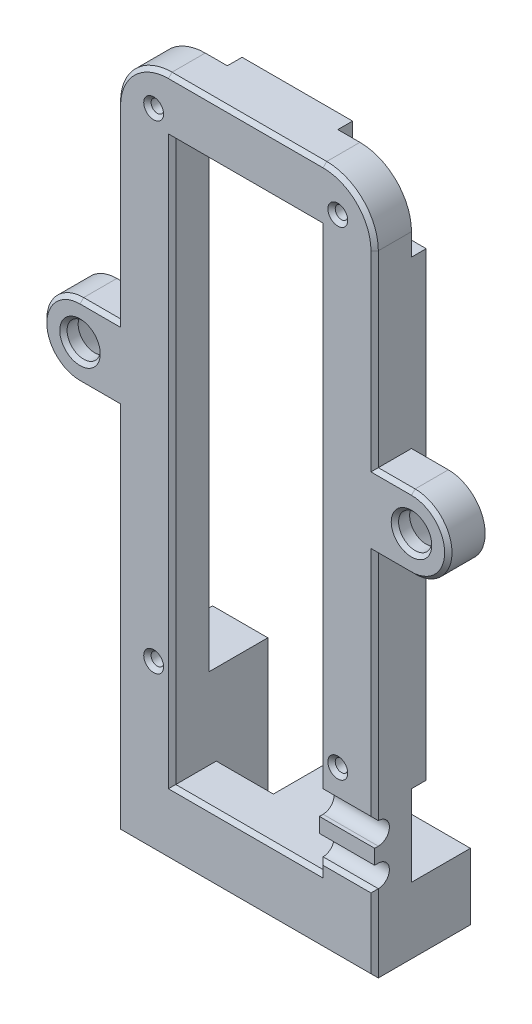
from build123d import *
from OCP.BRepFilletAPI import BRepFilletAPI_MakeChamfer

# Parameters (mm, degrees)
SKETCH1_R                = 0.85
BOSS_EXTRUDE1_DEPTH      = 5
BOSS_EXTRUDE2_DEPTH      = 2
SKETCH3_R                = 2.25
BOSS_EXTRUDE3_DEPTH      = 5
SKETCH4_R                = 3.5
CUT_EXTRUDE1_DEPTH       = 3
SKETCH5_W                = 10
SKETCH5_H                = 10
CUT_EXTRUDE2_DEPTH       = 47.770717335
FILLET1_R                = 7
BOSS_EXTRUDE4_DEPTH      = 5
BOSS_EXTRUDE4_DEPTH_BACK = 8
SKETCH6_W                = 7.5
SKETCH6_H                = 20
SKETCH7_W                = 6
SKETCH7_H                = 9
BOSS_EXTRUDE5_DEPTH      = 27.5
SKETCH8_W                = 19.75
SKETCH8_H                = 9
BOSS_EXTRUDE6_DEPTH      = 7
SKETCH9_W                = 7.5
SKETCH9_H                = 5
BOSS_EXTRUDE7_DEPTH      = 11
CUT_EXTRUDE3_DEPTH       = 7.5
CHAMFER3_SIZE            = 0.5
CHAMFER1_SIZE            = 2.5
CHAMFER1_SIZE_2          = 1.25


with BuildPart() as part:
    # Sketch1 → Boss-Extrude1 (new body)
    with BuildSketch(Plane.XY):
        Polygon((-10, -35), (-10, 30), (10, 30), (10, -35), (17.5, -35), (17.5, 37.5), (-17.5, 37.5), (-17.5, -35), align=None)
        with Locations((-12.5, 32.5)):
            Circle(SKETCH1_R, mode=Mode.SUBTRACT)
        with Locations((12.5, 32.5)):
            Circle(SKETCH1_R, mode=Mode.SUBTRACT)
        with Locations((-12.5, -32.5)):
            Circle(SKETCH1_R, mode=Mode.SUBTRACT)
        with Locations((12.5, -32.5)):
            Circle(SKETCH1_R, mode=Mode.SUBTRACT)
    extrude(amount=BOSS_EXTRUDE1_DEPTH)

    # Sketch2 → Boss-Extrude2 (add)
    with BuildSketch(Plane.XY):
        Polygon((17.5, -35), (17.5, 37.5), (-17.5, 37.5), (-17.5, -35), (-15.1, -35), (-15.1, 35.1), (15.1, 35.1), (15.1, -35), align=None)
    extrude(amount=-BOSS_EXTRUDE2_DEPTH)

    # Sketch3 → Boss-Extrude3 (add)
    # profile 1 of 2: a face of its own
    with BuildSketch(Plane.XY):
        with BuildLine():
            Line((22.5, 5), (17.5, 5))
            Line((17.5, 5), (17.5, -5))
            Line((17.5, -5), (22.5, -5))
            ThreePointArc((22.5, -5), (27.5, 0), (22.5, 5))
        make_face()
        with Locations(Location((22.5, 0, 0), (0, 0, 180))):
            Circle(SKETCH3_R, mode=Mode.SUBTRACT)
    # profile 2 of 2: a face of its own
    with BuildSketch(Plane.XY):
        with BuildLine():
            Line((-22.5, 5), (-17.5, 5))
            Line((-17.5, 5), (-17.5, -5))
            Line((-17.5, -5), (-22.5, -5))
            ThreePointArc((-22.5, -5), (-27.5, 0), (-22.5, 5))
        make_face()
        with Locations(Location((-22.5, 0, 0), (0, 0, 180))):
            Circle(SKETCH3_R, mode=Mode.SUBTRACT)
    extrude(amount=BOSS_EXTRUDE3_DEPTH)

    # Sketch4 → Cut-Extrude1 (cut)
    with BuildSketch(Plane(origin=(0, 0, 0), x_dir=(-1, 0, 0), z_dir=(0, 0, -1))):
        with Locations((-22.5, 0)):
            Circle(SKETCH4_R)
        with Locations((22.5, 0)):
            Circle(SKETCH4_R)
    extrude(amount=-CUT_EXTRUDE1_DEPTH, mode=Mode.SUBTRACT)

    # Sketch5 → Cut-Extrude2 (cut, through all)
    with BuildSketch(Plane(origin=(0, 0, 0), x_dir=(-1, 0, 0), z_dir=(0, 0, -1))):
        with Locations((-12.5, 32.5)):
            Rectangle(SKETCH5_W, SKETCH5_H)
        with Locations((12.5, 32.5)):
            Rectangle(SKETCH5_W, SKETCH5_H)
    extrude(amount=CUT_EXTRUDE2_DEPTH, mode=Mode.SUBTRACT)

    # Fillet1
    fillet1_edges = [part.edges().sort_by_distance(p)[0] for p in [
        (-17.5, 37.5, 2.5),
        (17.5, 37.5, 2.5),
    ]]
    fillet(fillet1_edges, radius=FILLET1_R)

    # Sketch6 → Boss-Extrude4 (add, two sides: drawn at the far end of the back side and taken through both)
    with BuildSketch(Plane.XY.offset(-BOSS_EXTRUDE4_DEPTH_BACK)):
        with Locations((-13.75, -45)):
            Rectangle(SKETCH6_W, SKETCH6_H)
    extrude(amount=BOSS_EXTRUDE4_DEPTH + BOSS_EXTRUDE4_DEPTH_BACK)

    # Sketch7 → Boss-Extrude5 (add)
    with BuildSketch(Plane(origin=(-10, 0, 0), x_dir=(0, 0, -1), z_dir=(1, 0, 0))):
        with Locations((-2, -50.5)):
            Rectangle(SKETCH7_W, SKETCH7_H)
    extrude(amount=BOSS_EXTRUDE5_DEPTH)

    # Sketch8 → Boss-Extrude6 (add)
    with BuildSketch(Plane(origin=(0, 0, -1), x_dir=(-1, 0, 0), z_dir=(0, 0, -1))):
        with Locations((-7.625, -50.5)):
            Rectangle(SKETCH8_W, SKETCH8_H)
    extrude(amount=BOSS_EXTRUDE6_DEPTH)

    # Sketch9 → Boss-Extrude7 (add)
    with BuildSketch(Plane.XZ.offset(35)):
        with Locations((13.75, 2.5)):
            Rectangle(SKETCH9_W, SKETCH9_H)
    extrude(amount=BOSS_EXTRUDE7_DEPTH)

    # Sketch10 → Cut-Extrude3 (cut)
    with BuildSketch(Plane(origin=(17.5, 0, 0), x_dir=(0, 0, -1), z_dir=(1, 0, 0))):
        with BuildLine():
            Line((-4.5, -36.5), (-6, -36.5))
            Line((-6, -36.5), (-6, -44.5))
            Line((-6, -44.5), (-4.5, -44.5))
            ThreePointArc((-4.5, -44.5), (-3, -43), (-4.5, -41.5))
            Line((-4.5, -41.5), (-5, -41.5))
            Line((-5, -41.5), (-5, -39.5))
            Line((-5, -39.5), (-4.5, -39.5))
            ThreePointArc((-4.5, -39.5), (-3, -38), (-4.5, -36.5))
        make_face()
    extrude(amount=-CUT_EXTRUDE3_DEPTH, mode=Mode.SUBTRACT)

    # Chamfer3
    chamfer3_edges = [part.edges().sort_by_distance(p)[0] for p in [
        (0, 30, 5),
        (-17.5, 17.75, 5),
        (0, 37.5, 5),
        (15.449747468, 35.449747468, 5),
        (-15.449747468, 35.449747468, 5),
        (10, -3.25, 5),
        (0, -55, 5),
        (-10, -8, 5),
        (0, -46, 5),
        (-13.35, 32.5, 0),
        (-13.35, 32.5, 5),
        (10, -45.25, 5),
        (17.5, -20.75, 5),
        (13.75, -44.5, 5),
        (13.75, -36.5, 5),
        (17.5, -49.75, 5),
        (11.65, 32.5, 0),
        (11.65, 32.5, 5),
        (-13.35, -32.5, 0),
        (-13.35, -32.5, 5),
        (11.65, -32.5, 0),
        (11.65, -32.5, 5),
        (17.5, 17.75, 5),
        (27.5, 0, 5),
        (20, 5, 5),
        (20, -5, 5),
        (24.75, 0, 5),
        (-17.5, -30, 5),
        (-27.5, 0, 5),
        (-20, -5, 5),
        (-20, 5, 5),
        (-20.25, 0, 5),
    ]]
    chamfer(chamfer3_edges, length=CHAMFER3_SIZE - 0.0001)  # a hair under: the kernel refuses the full size

    # Chamfer1
    chamfer1_edges_1 = [part.edges().sort_by_distance(p)[0] for p in [
        (26, 0, 3),
    ]]
    chamfer1_side_1 = [part.faces().sort_by_distance(p)[0] for p in [
        (26, 0, 2.975),
    ]]
    chamfer1_edges_2 = [part.edges().sort_by_distance(p)[0] for p in [
        (-19, 0, 3),
    ]]
    chamfer1_side_2 = [part.faces().sort_by_distance(p)[0] for p in [
        (-19, 0, 2.975),
    ]]
    chamfer1 = BRepFilletAPI_MakeChamfer(part.part.solid().wrapped)
    for e in chamfer1_edges_1:
        chamfer1.Add(CHAMFER1_SIZE - 0.0001, CHAMFER1_SIZE_2 - 0.0001, e.wrapped, chamfer1_side_1[0].wrapped)
    for e in chamfer1_edges_2:
        chamfer1.Add(CHAMFER1_SIZE - 0.0001, CHAMFER1_SIZE_2 - 0.0001, e.wrapped, chamfer1_side_2[0].wrapped)
    add(Compound.cast(chamfer1.Shape()), mode=Mode.REPLACE)  # a hair under: the kernel refuses the full size


solid = part.part
